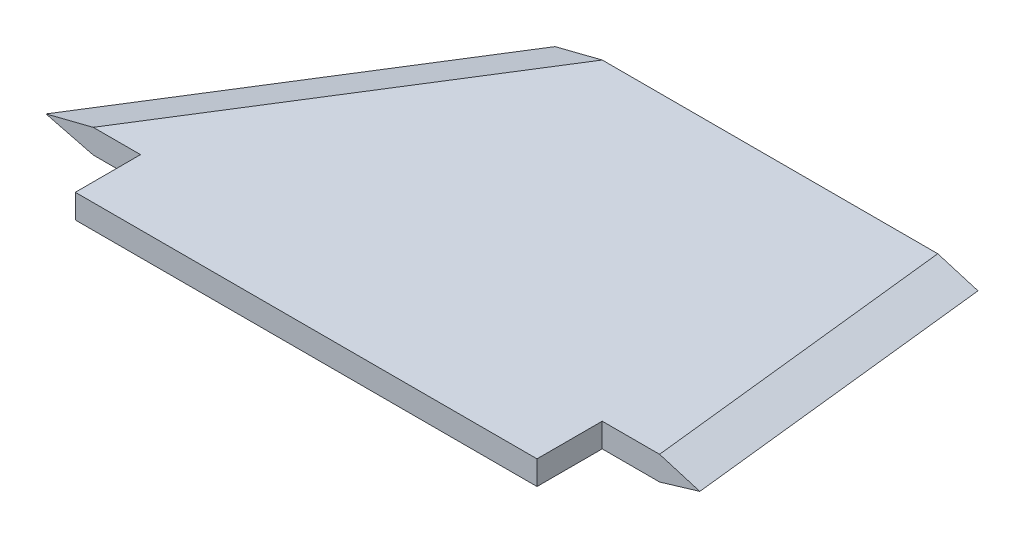
from build123d import *

# Parameters (mm, degrees)
BOSS_EXTRUDE1_DEPTH = 5.2832
SKETCH2_W           = 101.6
SKETCH2_H           = 14.351
BOSS_EXTRUDE2_DEPTH = 5.2832
CHAMFER1_SIZE       = 12.7
CHAMFER1_SIZE_2     = 3.81
CHAMFER2_SIZE       = 12.7
CHAMFER2_SIZE2      = 3.81
CHAMFER3_SIZE       = 3.81
CHAMFER3_SIZE_2     = 12.7


with BuildPart() as part:
    # Sketch1 → Boss-Extrude1 (new body)
    with BuildSketch(Plane(origin=(0, 0, 0), x_dir=(1, 0, 0), z_dir=(0, 1, 0))):
        Polygon((0, 0), (152.4, 0), (144.78, 68.834), (43.18, 68.834), align=None)
    extrude(amount=BOSS_EXTRUDE1_DEPTH)

    # Sketch2 → Boss-Extrude2 (add)
    with BuildSketch(Plane(origin=(0, 0, 0), x_dir=(1, 0, 0), z_dir=(0, 1, 0))):
        with Locations((76.2, -7.1755)):
            Rectangle(SKETCH2_W, SKETCH2_H)
    extrude(amount=BOSS_EXTRUDE2_DEPTH)

    # Chamfer1
    # the kernel refuses this chamfer: 12.7, 3.81 mm, written as the material it takes off along each edge
    with BuildSketch(Plane(origin=(60.699541801, 0, -96.762210753), x_dir=(0.8470671798621036, -0.011069119507992343, 0.531370555633054), z_dir=(-0.5314031118215187, 0, 0.8471190782566561))) as chamfer1_piece_1:
        Polygon((CHAMFER1_SIZE * 0.99993873542, CHAMFER1_SIZE * 0.011069119508), (-CHAMFER1_SIZE_2 * 0.011069119508, CHAMFER1_SIZE_2 * 0.99993873542), (0, 0), align=None)
    extrude(amount=147.193499363, mode=Mode.SUBTRACT)
    with BuildSketch(Plane(origin=(60.699541801, 5.2832, -96.762210753), x_dir=(0.8470671798621036, 0.01106911950799233, 0.531370555633054), z_dir=(-0.5314031118215187, 0, 0.8471190782566561))) as chamfer1_piece_2:
        Polygon((CHAMFER1_SIZE * 0.99993873542, -CHAMFER1_SIZE * 0.011069119508), (-CHAMFER1_SIZE_2 * 0.011069119508, -CHAMFER1_SIZE_2 * 0.99993873542), (0, 0), align=None)
    extrude(amount=147.193499363, mode=Mode.SUBTRACT)

    # Chamfer2
    chamfer2_edges = [part.edges().sort_by_distance(p)[0] for p in [
        (148.59, 0, -34.417),
    ]]
    chamfer2_side = [part.faces().sort_by_distance(p)[0] for p in [
        (89.414881318, 0, -25.614395123),
    ]]
    chamfer(chamfer2_edges, length=CHAMFER2_SIZE, length2=CHAMFER2_SIZE2, reference=chamfer2_side[0])

    # Chamfer3
    # the kernel refuses this chamfer: 12.7, 3.81 mm, written as the material it takes off along each edge
    with BuildSketch(Plane(origin=(156.027485672, 5.2832, 32.768287237), x_dir=(0.12133658482182727, -0.9925205348140393, -0.013432094260718893), z_dir=(-0.1100289719975825, 0, -0.9939283803781614))) as chamfer3_piece_1:
        Polygon((CHAMFER3_SIZE * 0.992520534814, CHAMFER3_SIZE * 0.122077794756), (-CHAMFER3_SIZE_2 * 0.122077794756, CHAMFER3_SIZE_2 * 0.992520534814), (0, 0), align=None)
    extrude(amount=135.191405264, mode=Mode.SUBTRACT)


solid = part.part
